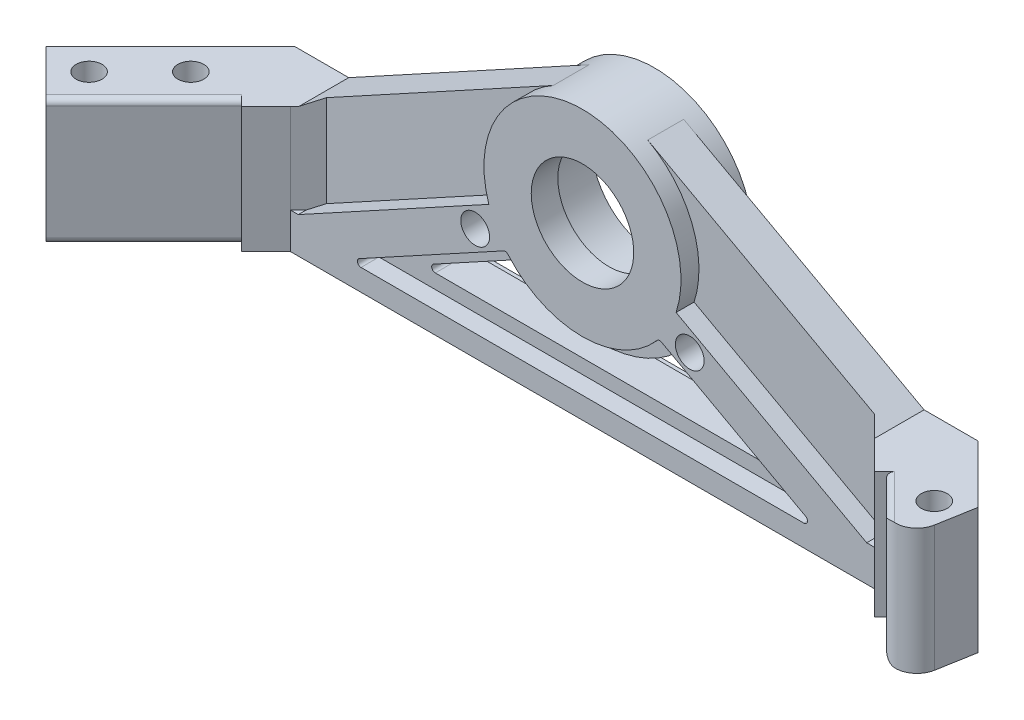
from build123d import *

# Parameters (mm, degrees)
BOSS_EXTRUDE1_DEPTH = 11.1125
BOSS_EXTRUDE2_DEPTH = 12.7
CUT_EXTRUDE2_DEPTH  = 8
CUT_EXTRUDE3_DEPTH  = 96.942967533
SKETCH5_W           = 25.144717139
SKETCH5_H           = 15.875
CUT_EXTRUDE4_DEPTH  = 3.175
CUT_EXTRUDE5_DEPTH  = 96.942967533
SKETCH6_R           = 2.54
CUT_EXTRUDE6_DEPTH  = 96.942967533
CUT_EXTRUDE7_START  = -3.175
CUT_EXTRUDE7_DEPTH  = 3.175
CHAMFER1_SIZE       = 3.175
FILLET1_R           = 0.635
FILLET3_R           = 1.016
SKETCH8_R           = 2.286
CUT_EXTRUDE8_DEPTH  = 93.295392221
CUT_EXTRUDE9_DEPTH  = 93.295392221
FILLET4_R           = 3.81
CUT_EXTRUDE10_DEPTH = 0.5


with BuildPart() as part:
    # Sketch3 → Boss-Extrude1 (new, symmetric)
    with BuildSketch(Plane(origin=(0, 0, 0), x_dir=(1, 0, 0), z_dir=(0, 1, 0))):
        Polygon((-56.934473853, -15.948934871), (-65.016704362, -7.866704362), (-82.294717139, -25.144717139), (-74.93090712, -32.508527158), (-74.21248663, -33.226947648), align=None)
        Polygon((-65.016704362, -7.866704362), (-55.873813681, -17.009595043), (-52.371513794, -13.507295156), (-61.514404475, -4.364404475), align=None)
        Polygon((-52.371513794, -13.507295156), (-51.564218639, -12.7), (-17.311249955, -12.7), (0, -12.7), (0, 0), (-17.311249955, 0), (-57.15, 0), (-60.325, -3.175), (-61.514404475, -4.364404475), align=None)
        Polygon((0, 0), (0, -12.7), (17.311249955, -12.7), (51.564218639, -12.7), (52.371513794, -13.507295156), (61.514404475, -4.364404475), (60.325, -3.175), (57.15, 0), (17.311249955, 0), align=None)
        Polygon((61.514404475, -4.364404475), (65.016704362, -7.866704362), (55.873813681, -17.009595043), (52.371513794, -13.507295156), align=None)
        Polygon((65.016704362, -7.866704362), (56.934473853, -15.948934871), (74.21248663, -33.226947648), (74.93090712, -32.508527158), (82.294717139, -25.144717139), align=None)
    extrude(amount=BOSS_EXTRUDE1_DEPTH, both=True)

    # Sketch2 → Boss-Extrude2 (add)
    with BuildSketch(Plane.XY):
        with BuildLine():
            Line((-50.804788276, 11.1125), (50.804788276, 11.1125))
            Line((50.804788276, 11.1125), (8.344749207, 34.318436746))
            ThreePointArc((8.344749207, 34.318436746), (0, 36.45), (-8.344749207, 34.318436746))
            Line((-8.344749207, 34.318436746), (-50.804788276, 11.1125))
        make_face()
    extrude(amount=BOSS_EXTRUDE2_DEPTH)

    # Sketch2<3> → Cut-Extrude2 (cut)
    with BuildSketch(Plane.XY):
        with BuildLine():
            ThreePointArc((0, 30.1), (-11.05, 19.05), (0, 8))
            Line((0, 8), (0, 10))
            ThreePointArc((0, 10), (-9.05, 19.05), (0, 28.1))
            Line((0, 28.1), (0, 30.1))
        make_face()
        with BuildLine():
            Line((0, 10), (0, 8))
            ThreePointArc((0, 8), (7.813529932, 11.236470068), (11.05, 19.05))
            ThreePointArc((11.05, 19.05), (7.813529932, 26.863529932), (0, 30.1))
            Line((0, 30.1), (0, 28.1))
            ThreePointArc((0, 28.1), (6.39931637, 25.44931637), (9.05, 19.05))
            ThreePointArc((9.05, 19.05), (6.39931637, 12.65068363), (0, 10))
        make_face()
        with BuildLine():
            ThreePointArc((0, 28.1), (-9.05, 19.05), (0, 10))
            Line((0, 10), (0, 28.1))
        make_face()
        with BuildLine():
            Line((0, 28.1), (0, 10))
            ThreePointArc((0, 10), (6.39931637, 12.65068363), (9.05, 19.05))
            ThreePointArc((9.05, 19.05), (6.39931637, 25.44931637), (0, 28.1))
        make_face()
    extrude(amount=CUT_EXTRUDE2_DEPTH, mode=Mode.SUBTRACT)

    # Sketch2<5> → Cut-Extrude3 (cut, through all)
    with BuildSketch(Plane.XY):
        with BuildLine():
            ThreePointArc((0, 28.1), (-9.05, 19.05), (0, 10))
            Line((0, 10), (0, 28.1))
        make_face()
        with BuildLine():
            Line((0, 28.1), (0, 10))
            ThreePointArc((0, 10), (6.39931637, 12.65068363), (9.05, 19.05))
            ThreePointArc((9.05, 19.05), (6.39931637, 25.44931637), (0, 28.1))
        make_face()
    extrude(amount=CUT_EXTRUDE3_DEPTH, mode=Mode.SUBTRACT)

    # Sketch5 → Cut-Extrude4 (cut)
    # profile 1 of 5: a face of its own
    with BuildSketch(Plane(origin=(0, 0, 0), x_dir=(-1, 0, 0), z_dir=(0, 0, -1))):
        with Locations((-69.72235857, 3.175)):
            Rectangle(SKETCH5_W, SKETCH5_H)
    # profile 2 of 5: a face of its own
    with BuildSketch(Plane(origin=(0, 0, 0), x_dir=(-1, 0, 0), z_dir=(0, 0, -1))):
        with BuildLine():
            Line((-50.190202202, -4.7625), (-16.534774751, 13.631400187))
            ThreePointArc((-16.534774751, 13.631400187), (-16.178258512, 25.454994263), (-8.344749207, 34.318436746))
            Line((-8.344749207, 34.318436746), (-50.804788276, 11.1125))
            Line((-50.804788276, 11.1125), (-57.15, 11.1125))
            Line((-57.15, 11.1125), (-57.15, -4.7625))
            Line((-57.15, -4.7625), (-50.190202202, -4.7625))
        make_face()
    # profile 3 of 5: a face of its own
    with BuildSketch(Plane(origin=(0, 0, 0), x_dir=(-1, 0, 0), z_dir=(0, 0, -1))):
        with BuildLine():
            Line((50.804788276, 11.1125), (8.344749207, 34.318436746))
            ThreePointArc((8.344749207, 34.318436746), (14.965938597, 27.925848236), (17.4, 19.05))
            ThreePointArc((17.4, 19.05), (17.182332215, 16.306378367), (16.534774751, 13.631400187))
            Line((16.534774751, 13.631400187), (50.190202202, -4.7625))
            Line((50.190202202, -4.7625), (57.15, -4.7625))
            Line((57.15, -4.7625), (57.15, 11.1125))
            Line((57.15, 11.1125), (50.804788276, 11.1125))
        make_face()
    # profile 4 of 5: a face of its own
    with BuildSketch(Plane(origin=(0, 0, 0), x_dir=(-1, 0, 0), z_dir=(0, 0, -1))):
        with Locations((69.72235857, 3.175)):
            Rectangle(SKETCH5_W, SKETCH5_H)
    # profile 5 of 5: a face of its own
    with BuildSketch(Plane(origin=(0, 0, 0), x_dir=(-1, 0, 0), z_dir=(0, 0, -1))):
        with BuildLine():
            ThreePointArc((13.489420874, 8.059298271), (0, 1.65), (-13.489420874, 8.059298271))
            Line((-13.489420874, 8.059298271), (-41.5969936, -7.3025))
            Line((-41.5969936, -7.3025), (41.5969936, -7.3025))
            Line((41.5969936, -7.3025), (13.489420874, 8.059298271))
        make_face()
        with BuildLine():
            Line((31.653276027, -4.7625), (-31.653276027, -4.7625))
            Line((-31.653276027, -4.7625), (-14.022402602, 4.873405723))
            ThreePointArc((-14.022402602, 4.873405723), (0, -0.89), (14.022402602, 4.873405723))
            Line((14.022402602, 4.873405723), (31.653276027, -4.7625))
        make_face(mode=Mode.SUBTRACT)
    extrude(amount=-CUT_EXTRUDE4_DEPTH, mode=Mode.SUBTRACT)

    # Sketch5<3> → Cut-Extrude5 (cut, through all)
    with BuildSketch(Plane(origin=(0, 0, 0), x_dir=(-1, 0, 0), z_dir=(0, 0, -1))):
        with BuildLine():
            ThreePointArc((-14.022402602, 4.873405723), (0, -0.89), (14.022402602, 4.873405723))
            Line((14.022402602, 4.873405723), (31.653276027, -4.7625))
            Line((31.653276027, -4.7625), (-31.653276027, -4.7625))
            Line((-31.653276027, -4.7625), (-14.022402602, 4.873405723))
        make_face()
    extrude(amount=-CUT_EXTRUDE5_DEPTH, mode=Mode.SUBTRACT)

    # Sketch6 → Cut-Extrude6 (cut, through all)
    with BuildSketch(Plane(origin=(0, 0, 0), x_dir=(-1, 0, 0), z_dir=(0, 0, -1))):
        with Locations((-18.945146514, 8.695796817)):
            Circle(SKETCH6_R)
        with Locations((18.945146514, 8.695796817)):
            Circle(SKETCH6_R)
    extrude(amount=-CUT_EXTRUDE6_DEPTH, mode=Mode.SUBTRACT)

    # Sketch7 → Cut-Extrude7 (cut)
    # profile 1 of 3: a face of its own
    with BuildSketch(Plane.XY.offset(12.7).offset(CUT_EXTRUDE7_START)):
        with BuildLine():
            ThreePointArc((13.489420874, 8.059298271), (0, 1.65), (-13.489420874, 8.059298271))
            Line((-13.489420874, 8.059298271), (-41.5969936, -7.3025))
            Line((-41.5969936, -7.3025), (41.5969936, -7.3025))
            Line((41.5969936, -7.3025), (13.489420874, 8.059298271))
        make_face()
        with BuildLine():
            Line((-31.653276027, -4.7625), (-14.022402602, 4.873405723))
            ThreePointArc((-14.022402602, 4.873405723), (0, -0.89), (14.022402602, 4.873405723))
            Line((14.022402602, 4.873405723), (31.653276027, -4.7625))
            Line((31.653276027, -4.7625), (-31.653276027, -4.7625))
        make_face(mode=Mode.SUBTRACT)
    # profile 2 of 3: a face of its own
    with BuildSketch(Plane.XY.offset(12.7).offset(CUT_EXTRUDE7_START)):
        with BuildLine():
            Line((-51.564218639, -4.7625), (-50.190202202, -4.7625))
            Line((-50.190202202, -4.7625), (-16.534774751, 13.631400187))
            ThreePointArc((-16.534774751, 13.631400187), (-16.178258512, 25.454994263), (-8.344749207, 34.318436746))
            Line((-8.344749207, 34.318436746), (-50.804788276, 11.1125))
            Line((-50.804788276, 11.1125), (-51.564218639, 11.1125))
            Line((-51.564218639, 11.1125), (-51.564218639, -4.7625))
        make_face()
    # profile 3 of 3: a face of its own
    with BuildSketch(Plane.XY.offset(12.7).offset(CUT_EXTRUDE7_START)):
        with BuildLine():
            Line((50.804788276, 11.1125), (8.344749207, 34.318436746))
            ThreePointArc((8.344749207, 34.318436746), (14.965938597, 27.925848236), (17.4, 19.05))
            ThreePointArc((17.4, 19.05), (17.182332215, 16.306378367), (16.534774751, 13.631400187))
            Line((16.534774751, 13.631400187), (50.190202202, -4.7625))
            Line((50.190202202, -4.7625), (51.564218639, -4.7625))
            Line((51.564218639, -4.7625), (51.564218639, 11.1125))
            Line((51.564218639, 11.1125), (50.804788276, 11.1125))
        make_face()
    extrude(amount=CUT_EXTRUDE7_DEPTH, mode=Mode.SUBTRACT)

    # Chamfer1
    # the kernel refuses this chamfer: 3.175 mm, written as the material it adds along each edge
    with BuildSketch(Plane(origin=(51.564218639, -4.7625, 9.525), x_dir=(0, 0, 1), z_dir=(0, 1, 0))) as chamfer1_piece_1_section:
        Polygon((CHAMFER1_SIZE, 0), (0, -CHAMFER1_SIZE), (0, 0), align=None)
    chamfer1_piece_1 = extrude(amount=24.040093487, mode=Mode.PRIVATE)
    chamfer1_piece_1 = split(chamfer1_piece_1, bisect_by=Plane(origin=(58.070266948, 7.14165489, 9.525), z_dir=(-0.47958328775301867, -0.8774963647263762, 0)), keep=Keep.TOP, mode=Mode.PRIVATE)
    add(chamfer1_piece_1)
    with BuildSketch(Plane(origin=(51.564218639, -12.927593487, 9.525), x_dir=(0, 0, 1), z_dir=(0, 1, 0))) as chamfer1_piece_2_section:
        Polygon((CHAMFER1_SIZE, 0), (0, -CHAMFER1_SIZE), (0, 0), align=None)
    chamfer1_piece_2 = extrude(amount=24.040093487, mode=Mode.PRIVATE)
    chamfer1_piece_2 = split(chamfer1_piece_2, bisect_by=Plane(origin=(61.506404401, 5.263682328, 9.525), z_dir=(0.47958328775301867, 0.8774963647263762, 0)), keep=Keep.TOP, mode=Mode.PRIVATE)
    add(chamfer1_piece_2)
    with BuildSketch(Plane(origin=(-51.564218639, 11.1125, 9.525), x_dir=(1, 0, 0), z_dir=(0, -1, 0))) as chamfer1_piece_3_section:
        Polygon((CHAMFER1_SIZE, 0), (0, CHAMFER1_SIZE), (0, 0), align=None)
    chamfer1_piece_3 = extrude(amount=24.040093487, mode=Mode.PRIVATE)
    chamfer1_piece_3 = split(chamfer1_piece_3, bisect_by=Plane(origin=(-44.567477288, -1.689478836, 9.525), z_dir=(-0.47958328775301895, 0.877496364726376, 0)), keep=Keep.TOP, mode=Mode.PRIVATE)
    add(chamfer1_piece_3)
    with BuildSketch(Plane(origin=(-51.564218639, 19.277593487, 9.525), x_dir=(1, 0, 0), z_dir=(0, -1, 0))) as chamfer1_piece_4_section:
        Polygon((CHAMFER1_SIZE, 0), (0, CHAMFER1_SIZE), (0, 0), align=None)
    chamfer1_piece_4 = extrude(amount=32.205186974, mode=Mode.PRIVATE)
    chamfer1_piece_4 = split(chamfer1_piece_4, bisect_by=Plane(origin=(-47.953412104, 12.670879515, 9.525), z_dir=(0.47958328775301867, -0.8774963647263762, 0)), keep=Keep.TOP, mode=Mode.PRIVATE)
    chamfer1_piece_4 = split(chamfer1_piece_4, bisect_by=Plane(origin=(-41.131339836, 0.188493727, 9.525), z_dir=(-0.47958328775301895, 0.877496364726376, 0)), keep=Keep.TOP, mode=Mode.PRIVATE)
    add(chamfer1_piece_4)

    # Fillet1
    fillet1_edges = [part.edges().sort_by_distance(p)[0] for p in [
        (13.489420874, 8.059298271, 1.5875),
        (-13.489420874, 8.059298271, 1.5875),
        (-41.5969936, -7.3025, 1.5875),
        (41.5969936, -7.3025, 1.5875),
        (14.022402602, 4.873405723, 6.35),
        (31.653276027, -4.7625, 6.35),
        (-31.653276027, -4.7625, 6.35),
        (-14.022402602, 4.873405723, 6.35),
        (-13.489420874, 8.059298271, 11.1125),
        (13.489420874, 8.059298271, 11.1125),
        (41.5969936, -7.3025, 11.1125),
        (-41.5969936, -7.3025, 11.1125),
    ]]
    fillet(fillet1_edges, radius=FILLET1_R)

    # Fillet3
    fillet3_edges = [part.edges().sort_by_distance(p)[0] for p in [
        (65.573480242, -11.1125, 24.587941259),
        (-65.573480242, -11.1125, 24.587941259),
        (65.573480242, 11.1125, 24.587941259),
        (-65.573480242, 11.1125, 24.587941259),
    ]]
    fillet(fillet3_edges, radius=FILLET3_R)

    # Sketch8 → Cut-Extrude8 (cut, through all)
    with BuildSketch(Plane(origin=(0, 11.1125, 0), x_dir=(1, 0, 0), z_dir=(0, 1, 0))):
        with Locations(Location((74.625578412, -25.198598676, 0), (0, 0, 270))):
            Circle(SKETCH8_R)
        with Locations(Location((-74.625578412, -25.198598676, 0), (0, 0, 270))):
            Circle(SKETCH8_R)
        with Locations(Location((65.645322291, -16.218342555, 0), (0, 0, 270))):
            Circle(SKETCH8_R)
        with Locations(Location((-65.645322291, -16.218342555, 0), (0, 0, 90))):
            Circle(SKETCH8_R)
    extrude(amount=-CUT_EXTRUDE8_DEPTH, mode=Mode.SUBTRACT)

    # Sketch9 → Cut-Extrude9 (cut, through all)
    with BuildSketch(Plane(origin=(0, 11.1125, 0), x_dir=(1, 0, 0), z_dir=(0, 1, 0))):
        Polygon((70.485, -13.335), (65.639402848, -40.815747031), (98.201631383, -40.815747031), (98.201631383, -13.335), align=None)
    extrude(amount=-CUT_EXTRUDE9_DEPTH, mode=Mode.SUBTRACT)

    # Fillet4
    # the kernel refuses this fillet: 3.81 mm, written as the material it takes off along each edge
    with BuildSketch(Plane(origin=(68.062008219, 28.393854759, 27.076469237), x_dir=(0.1736481776669248, 0, -0.9848077530122091), z_dir=(0, -1, 0))) as fillet4_piece_1:
        with BuildLine():
            CenterArc((FILLET4_R * 1.92098212697, -FILLET4_R), FILLET4_R, 90, 125)
            Line((FILLET4_R * 1.10183008268, -FILLET4_R * 1.57357643635), (0, 0))
            Line((0, 0), (FILLET4_R * 1.92098212697, 0))
        make_face()
    extrude(amount=56.787709519, mode=Mode.SUBTRACT)

    # Sketch10 → Cut-Extrude10 (cut)
    # profile 1 of 5: a face of its own
    with BuildSketch(Plane.XZ.offset(11.1125)):
        with BuildLine():
            Line((6.955128205, 5.655889423), (6.573717949, 5.452564103))
            add(Edge.make_bspline(
                [(6.573717949, 5.452564103), (6.545922437, 5.498605223), (6.492797515, 5.586602559), (6.405563696, 5.705145418), (6.318829653, 5.806231322), (6.231739217, 5.889758205), (6.143082637, 5.95438438), (6.053764997, 6.001091066), (5.963227276, 6.030447771), (5.9020118, 6.034100411), (5.871895032, 6.035897436)],
                knots=[0, 0, 0, 0, 1.354943589, 2.589672558, 3.704607527, 4.708856974, 5.624398268, 6.459549776, 7.242129862, 8, 8, 8, 8], degree=3))
            add(Edge.make_bspline(
                [(5.871895032, 6.035897436), (5.843777409, 6.034998249), (5.788084486, 6.03321722), (5.706289617, 6.017626176), (5.626860085, 5.99419681), (5.551935483, 5.959511514), (5.48244247, 5.918382044), (5.420674582, 5.869797955), (5.368082166, 5.814645054), (5.325239521, 5.753088186), (5.291507213, 5.688001962), (5.267412618, 5.620080583), (5.252956595, 5.549928839), (5.250989532, 5.502409986), (5.25, 5.478505609)],
                knots=[0, 0, 0, 0, 1.088711937, 2.156425153, 3.216543554, 4.290691142, 5.346933412, 6.339926723, 7.326538423, 8.288906172, 9.236802047, 10.159214894, 11.073992371, 12, 12, 12, 12], degree=3))
            add(Edge.make_bspline(
                [(5.25, 5.478505609), (5.251289441, 5.451237129), (5.253897944, 5.396073728), (5.277544855, 5.314729095), (5.312451573, 5.233254329), (5.346112616, 5.182849411), (5.363581731, 5.156690705)],
                knots=[0, 0, 0, 0, 0.942144539, 1.905933023, 2.913239343, 4, 4, 4, 4], degree=3))
            add(Edge.make_bspline(
                [(5.363581731, 5.156690705), (5.378599068, 5.137617448), (5.410211837, 5.097466622), (5.463771743, 5.037071303), (5.526108213, 4.973940726), (5.598480894, 4.909395911), (5.677065406, 4.839348386), (5.765885722, 4.768357575), (5.862751255, 4.693916401), (5.930689868, 4.644038805), (5.965845353, 4.618229167)],
                knots=[0, 0, 0, 0, 0.718605451, 1.5127255, 2.388525841, 3.34361075, 4.383114545, 5.504804886, 6.708837455, 8, 8, 8, 8], degree=3))
            add(Edge.make_bspline(
                [(5.965845353, 4.618229167), (6.00168954, 4.592171602), (6.070464497, 4.542174431), (6.167362407, 4.468878347), (6.254240814, 4.401295296), (6.3304335, 4.339372455), (6.395949126, 4.282571618), (6.450649678, 4.231125865), (6.496181868, 4.186447001), (6.520649569, 4.156384964), (6.531650641, 4.14286859)],
                knots=[0, 0, 0, 0, 1.435833971, 2.754963323, 3.936484598, 5.002077172, 5.935979083, 6.744956812, 7.435712417, 8, 8, 8, 8], degree=3))
            add(Edge.make_bspline(
                [(6.531650641, 4.14286859), (6.547710719, 4.122117406), (6.579262034, 4.081350037), (6.61920709, 4.015956536), (6.653578917, 3.949707187), (6.681889214, 3.881988561), (6.703827988, 3.813016997), (6.718920828, 3.742550617), (6.729567054, 3.670869327), (6.730367062, 3.622441786), (6.730769231, 3.598096955)],
                knots=[0, 0, 0, 0, 1.064105702, 2.090521257, 3.104283852, 4.09061442, 5.065433238, 6.036507983, 7.012940167, 8, 8, 8, 8], degree=3))
            add(Edge.make_bspline(
                [(6.730769231, 3.598096955), (6.729515083, 3.560126606), (6.727031963, 3.484948093), (6.704399939, 3.375068313), (6.668607851, 3.26994227), (6.617838539, 3.171328353), (6.554959306, 3.080088965), (6.479870762, 2.998403207), (6.392434284, 2.927813249), (6.294689139, 2.868139824), (6.189328785, 2.819749269), (6.078360338, 2.785257467), (5.963128198, 2.764347606), (5.884835503, 2.761630248), (5.845252404, 2.76025641)],
                knots=[0, 0, 0, 0, 1.004538361, 1.98891246, 2.957754601, 3.937604432, 4.916182936, 5.884154884, 6.865254872, 7.882148152, 8.909646262, 9.927556077, 10.952217026, 12, 12, 12, 12], degree=3))
            add(Edge.make_bspline(
                [(5.845252404, 2.76025641), (5.800288489, 2.761765646), (5.711198198, 2.764756006), (5.58029896, 2.787799883), (5.45446477, 2.825234465), (5.353568286, 2.868466228), (5.275055104, 2.912290321), (5.215686682, 2.951924562), (5.154833361, 2.996764375), (5.09442727, 3.049062555), (5.032112714, 3.106283691), (4.9710811, 3.171539686), (4.907469941, 3.241090211), (4.86692652, 3.291248304), (4.846153846, 3.316947115)],
                knots=[0, 0, 0, 0, 1.360687177, 2.696028959, 4.010076158, 5.328383209, 6.009416266, 6.72960499, 7.488083515, 8.296188009, 9.147227534, 10.04798982, 10.999875445, 12, 12, 12, 12], degree=3))
            Line((4.846153846, 3.316947115), (5.212139423, 3.567948718))
            add(Edge.make_bspline(
                [(5.212139423, 3.567948718), (5.231197788, 3.547515179), (5.267953877, 3.508106922), (5.322642771, 3.45291865), (5.373784064, 3.403079657), (5.421450494, 3.358595495), (5.466336542, 3.319984295), (5.508000192, 3.286910753), (5.546973362, 3.260282729), (5.593160244, 3.230943128), (5.651920246, 3.204105222), (5.723895671, 3.180794058), (5.798937681, 3.16714817), (5.849638961, 3.165128681), (5.875400641, 3.164102564)],
                knots=[0, 0, 0, 0, 1.253255604, 2.417037033, 3.484535688, 4.456276324, 5.340879413, 6.139846054, 6.840628373, 7.457335203, 8.592193832, 9.725986821, 10.844557802, 12, 12, 12, 12], degree=3))
            add(Edge.make_bspline(
                [(5.875400641, 3.164102564), (5.902885124, 3.165396572), (5.956317203, 3.167912228), (6.032932005, 3.189110321), (6.103119698, 3.223200893), (6.165194449, 3.27097975), (6.217718177, 3.329639699), (6.255574284, 3.399162998), (6.277829561, 3.478036176), (6.280604327, 3.533445496), (6.282051282, 3.562339744)],
                knots=[0, 0, 0, 0, 1.033786987, 2.00976631, 2.970458119, 3.95651055, 4.942051941, 5.915168215, 6.91282465, 8, 8, 8, 8], degree=3))
            add(Edge.make_bspline(
                [(6.282051282, 3.562339744), (6.28149088, 3.581062134), (6.28037143, 3.618461629), (6.272009308, 3.67382967), (6.256922644, 3.72753238), (6.23645815, 3.780017787), (6.209395004, 3.831703254), (6.175597302, 3.882906129), (6.134357789, 3.933943781), (6.102846717, 3.966210779), (6.086438301, 3.983012821)],
                knots=[0, 0, 0, 0, 0.941102048, 1.879927795, 2.806320176, 3.740133313, 4.70706341, 5.733547381, 6.819814909, 8, 8, 8, 8], degree=3))
            add(Edge.make_bspline(
                [(6.086438301, 3.983012821), (6.078121626, 3.990836739), (6.059033112, 4.008794272), (6.024022728, 4.036292581), (5.981368032, 4.070768116), (5.930477678, 4.111658174), (5.869678278, 4.156742774), (5.801217798, 4.209033937), (5.723362816, 4.266177574), (5.668576046, 4.306239142), (5.639823718, 4.327263622)],
                knots=[0, 0, 0, 0, 0.485581606, 1.114511607, 1.892484918, 2.819534315, 3.891398566, 5.11240712, 6.484579029, 8, 8, 8, 8], degree=3))
            add(Edge.make_bspline(
                [(5.639823718, 4.327263622), (5.600647247, 4.355810699), (5.524859001, 4.411036014), (5.417274927, 4.494420765), (5.320111394, 4.575739513), (5.231859623, 4.653699656), (5.153297125, 4.728862304), (5.085159515, 4.802258672), (5.025718972, 4.871778844), (4.962356185, 4.960505052), (4.898616052, 5.06962878), (4.843298524, 5.202280536), (4.808089766, 5.335069751), (4.80353079, 5.424082684), (4.801282051, 5.467988782)],
                knots=[0, 0, 0, 0, 1.186639563, 2.29559556, 3.331401308, 4.287832086, 5.178002532, 5.991653193, 6.738845359, 7.415240842, 8.658551622, 9.823054859, 10.926210341, 12, 12, 12, 12], degree=3))
            add(Edge.make_bspline(
                [(4.801282051, 5.467988782), (4.802275506, 5.499122385), (4.804250073, 5.561002801), (4.818566607, 5.652496737), (4.842387021, 5.741426577), (4.876660762, 5.827412615), (4.919396348, 5.91127786), (4.972439298, 5.992227342), (5.035257903, 6.070059394), (5.106262482, 6.144446648), (5.183899032, 6.213576047), (5.267788427, 6.274099775), (5.356348148, 6.325831589), (5.450294329, 6.366808857), (5.548106527, 6.400426022), (5.651087312, 6.423387681), (5.758665045, 6.436656939), (5.831894176, 6.438703864), (5.869090545, 6.43974359)],
                knots=[0, 0, 0, 0, 0.932738639, 1.853889356, 2.767877299, 3.686041414, 4.622558463, 5.584089528, 6.580490983, 7.61578374, 8.662665956, 9.690923261, 10.710750907, 11.729736566, 12.757349726, 13.805636525, 14.885384091, 16, 16, 16, 16], degree=3))
            add(Edge.make_bspline(
                [(5.869090545, 6.43974359), (5.896214412, 6.439141134), (5.949637214, 6.437954545), (6.028947511, 6.430427802), (6.106126309, 6.415961477), (6.181596753, 6.397257975), (6.255405946, 6.373441591), (6.326602693, 6.34297607), (6.396372582, 6.307982208), (6.464315382, 6.267008021), (6.530517733, 6.219030474), (6.595355852, 6.163337979), (6.658453112, 6.09895153), (6.720891134, 6.026707642), (6.781845028, 5.945793723), (6.841172492, 5.856635242), (6.899631031, 5.759519711), (6.936264526, 5.691113712), (6.955128205, 5.655889423)],
                knots=[0, 0, 0, 0, 0.916943493, 1.805999526, 2.689245248, 3.568702553, 4.433092864, 5.307568578, 6.183755457, 7.069823058, 7.986358083, 8.944343836, 9.955449961, 11.030835633, 12.170024038, 13.377301724, 14.649494474, 16, 16, 16, 16], degree=3))
        make_face()
    # profile 2 of 5: a face of its own
    with BuildSketch(Plane.XZ.offset(11.1125)):
        Polygon((4.128205128, 6.35), (4.128205128, 2.85), (3.962039263, 2.85), (1.83974359, 5.509354968), (1.83974359, 2.85), (1.391025641, 2.85), (1.391025641, 6.35), (1.574719551, 6.35), (3.679487179, 3.69765625), (3.679487179, 6.35), align=None)
    # profile 3 of 5: a face of its own
    with BuildSketch(Plane.XZ.offset(11.1125)):
        Polygon((0.043469551, 2.85), (-0.717948718, 2.85), (-0.717948718, 6.35), (-0.269230769, 6.35), (-0.269230769, 3.253846154), (0.269230769, 3.253846154), align=None)
    # profile 4 of 5: a face of its own
    with BuildSketch(Plane.XZ.offset(11.1125)):
        with BuildLine():
            add(Edge.make_bspline(
                [(-1.929487179, 4.601402244), (-1.929820024, 4.545772786), (-1.930466421, 4.437738209), (-1.937473576, 4.280579568), (-1.949475503, 4.133047998), (-1.965186437, 3.99497525), (-1.985981936, 3.866455085), (-2.01210377, 3.747657913), (-2.041666608, 3.638070524), (-2.077057072, 3.537721733), (-2.116884293, 3.445335588), (-2.159279173, 3.358445926), (-2.207248145, 3.277982304), (-2.258445983, 3.202763868), (-2.313138476, 3.132633266), (-2.372968524, 3.069102006), (-2.436199286, 3.01043296), (-2.503346552, 2.957979374), (-2.573759685, 2.911897493), (-2.645716894, 2.870677498), (-2.720506077, 2.837466064), (-2.796608784, 2.808773511), (-2.875043288, 2.787234356), (-2.955710335, 2.771953379), (-3.038153153, 2.761483068), (-3.094018037, 2.760666707), (-3.122095353, 2.76025641)],
                knots=[0, 0, 0, 0, 1.622605109, 3.151162473, 4.587442309, 5.939538287, 7.20372481, 8.383107478, 9.486239959, 10.512528934, 11.483748244, 12.419707751, 13.330476935, 14.213498841, 15.072700274, 15.92158999, 16.756207925, 17.586695167, 18.403499641, 19.2093348, 20.002585959, 20.787710657, 21.579935901, 22.371427536, 23.181490415, 24, 24, 24, 24], degree=3))
            add(Edge.make_bspline(
                [(-3.122095353, 2.76025641), (-3.152731517, 2.761033674), (-3.213201864, 2.762567854), (-3.302787896, 2.771651823), (-3.389864801, 2.78757717), (-3.474185977, 2.81134458), (-3.556619955, 2.83954235), (-3.63604835, 2.875891171), (-3.713266346, 2.917848905), (-3.787678328, 2.966252878), (-3.858415308, 3.020964068), (-3.925441203, 3.081687718), (-3.988267508, 3.148014653), (-4.046907915, 3.220326578), (-4.101416121, 3.2977732), (-4.151425746, 3.381374377), (-4.197578861, 3.470324753), (-4.240034798, 3.565409639), (-4.277149587, 3.667580194), (-4.309407109, 3.777408534), (-4.336484753, 3.895211611), (-4.358892888, 4.021105793), (-4.376144672, 4.154950988), (-4.388881636, 4.296670021), (-4.395532446, 4.44639057), (-4.396790125, 4.548812409), (-4.397435897, 4.601402244)],
                knots=[0, 0, 0, 0, 0.874832558, 1.726764085, 2.568361456, 3.398879789, 4.226201588, 5.053523386, 5.889679481, 6.733707388, 7.585299078, 8.4404393, 9.313717912, 10.191269597, 11.096596538, 12.015593249, 12.970707924, 13.956566593, 14.986800884, 16.072143337, 17.223061702, 18.436511454, 19.721974523, 21.075312687, 22.498281019, 24, 24, 24, 24], degree=3))
            add(Edge.make_bspline(
                [(-4.397435897, 4.601402244), (-4.396782502, 4.653757336), (-4.395510127, 4.755709971), (-4.388966535, 4.904744814), (-4.375857992, 5.045682145), (-4.359906802, 5.178975556), (-4.336868841, 5.303968911), (-4.311081981, 5.421313071), (-4.278377775, 5.530191748), (-4.241956283, 5.631910666), (-4.200730937, 5.726917543), (-4.153785212, 5.815343618), (-4.104592007, 5.899021968), (-4.050060208, 5.976726285), (-3.991471708, 6.048656628), (-3.928478795, 6.115269439), (-3.861485674, 6.17603404), (-3.790212069, 6.231128369), (-3.715479627, 6.279794991), (-3.638364874, 6.322876937), (-3.558372006, 6.358984162), (-3.47592898, 6.388001652), (-3.391043214, 6.411839285), (-3.303435357, 6.427402676), (-3.213482705, 6.437646554), (-3.152739512, 6.439040408), (-3.122095353, 6.43974359)],
                knots=[0, 0, 0, 0, 1.49659969, 2.914373258, 4.262463443, 5.541784011, 6.749918813, 7.89402581, 8.97408983, 9.996834451, 10.981022981, 11.93120719, 12.856888794, 13.753851156, 14.64171265, 15.506454614, 16.371918745, 17.224394982, 18.078544691, 18.918788586, 19.746969722, 20.583674387, 21.415055378, 22.264095942, 23.124258755, 24, 24, 24, 24], degree=3))
            add(Edge.make_bspline(
                [(-3.122095353, 6.43974359), (-3.09379246, 6.439262863), (-3.037736562, 6.438310748), (-2.954962623, 6.428966204), (-2.874322736, 6.413472536), (-2.796083047, 6.391704526), (-2.719785436, 6.364330767), (-2.645951414, 6.33048748), (-2.574212715, 6.290386167), (-2.504974112, 6.244015703), (-2.438313207, 6.192389521), (-2.375492482, 6.134420479), (-2.316719786, 6.07040235), (-2.26121611, 6.000976337), (-2.209744799, 5.925591128), (-2.163065245, 5.843940476), (-2.119409324, 5.756680398), (-2.07933584, 5.66314306), (-2.043193198, 5.562154409), (-2.012518016, 5.452245215), (-1.986781079, 5.333047342), (-1.966139854, 5.20450334), (-1.949205111, 5.067012571), (-1.937551448, 4.920113235), (-1.930454678, 4.763900402), (-1.929815614, 4.656565118), (-1.929487179, 4.601402244)],
                knots=[0, 0, 0, 0, 0.826227461, 1.636402404, 2.428761462, 3.221854935, 4.005495932, 4.793404576, 5.590831925, 6.402844393, 7.224663165, 8.050552332, 8.895728592, 9.760111832, 10.644101474, 11.558317463, 12.504453911, 13.491971134, 14.528097073, 15.634271589, 16.821614375, 18.087186367, 19.434798266, 20.865849934, 22.389264722, 24, 24, 24, 24], degree=3))
        make_face()
        with BuildLine():
            add(Edge.make_bspline(
                [(-2.378205128, 4.6), (-2.378419726, 4.646978143), (-2.378835172, 4.737924313), (-2.383553365, 4.869584142), (-2.392507878, 4.992010362), (-2.402014458, 5.10560144), (-2.417187446, 5.210052574), (-2.43417632, 5.305659219), (-2.455212435, 5.392009987), (-2.479161501, 5.469956862), (-2.506024847, 5.540860229), (-2.535825564, 5.606139939), (-2.566716304, 5.667314607), (-2.601696035, 5.722840453), (-2.637826639, 5.774385586), (-2.677248131, 5.820847469), (-2.719335124, 5.862303347), (-2.777555397, 5.909959052), (-2.852043249, 5.959857009), (-2.944753063, 6.00300953), (-3.038190548, 6.031176958), (-3.101340061, 6.03433403), (-3.132612179, 6.035897436)],
                knots=[0, 0, 0, 0, 1.565050911, 3.029821469, 4.387792543, 5.654509782, 6.826079957, 7.902709307, 8.888453275, 9.784884885, 10.617798265, 11.412307314, 12.174931846, 12.898730956, 13.596561216, 14.270483471, 14.92565982, 15.561680851, 16.775288496, 17.900403612, 18.96026391, 20, 20, 20, 20], degree=3))
            add(Edge.make_bspline(
                [(-3.132612179, 6.035897436), (-3.168054227, 6.034058471), (-3.238491124, 6.030403744), (-3.34261479, 6.00330136), (-3.442241405, 5.957590126), (-3.521609932, 5.906501163), (-3.581382078, 5.856874548), (-3.624246304, 5.8146102), (-3.66449279, 5.768073914), (-3.701752084, 5.716682081), (-3.735741366, 5.660292891), (-3.768453883, 5.600087809), (-3.796952303, 5.534691513), (-3.813420097, 5.489117655), (-3.821814904, 5.465885417)],
                knots=[0, 0, 0, 0, 1.332284016, 2.647757677, 4.016941371, 5.440902831, 6.183743781, 6.935888695, 7.702483601, 8.495487208, 9.320161261, 10.177499591, 11.070941831, 12, 12, 12, 12], degree=3))
            add(Edge.make_bspline(
                [(-3.821814904, 5.465885417), (-3.831929041, 5.435361862), (-3.85254741, 5.373137481), (-3.878379392, 5.276258244), (-3.899765093, 5.174602806), (-3.918179373, 5.068712538), (-3.932161364, 4.95805397), (-3.941825857, 4.842733688), (-3.947369549, 4.722750985), (-3.948263486, 4.641371816), (-3.948717949, 4.6)],
                knots=[0, 0, 0, 0, 0.877617242, 1.789083553, 2.735016418, 3.71249782, 4.722174671, 5.778575778, 6.870664861, 8, 8, 8, 8], degree=3))
            add(Edge.make_bspline(
                [(-3.948717949, 4.6), (-3.948608725, 4.558624069), (-3.948395719, 4.477934078), (-3.94209743, 4.359902323), (-3.934450595, 4.247559434), (-3.921345323, 4.141010587), (-3.906323118, 4.040122019), (-3.88762759, 3.944993441), (-3.86425341, 3.856240158), (-3.8386314, 3.772957339), (-3.808880154, 3.695983195), (-3.777431111, 3.62396806), (-3.743341134, 3.557627664), (-3.706562256, 3.496727767), (-3.667551009, 3.441112765), (-3.625087361, 3.391371184), (-3.581383507, 3.346161322), (-3.519748428, 3.295331926), (-3.439673756, 3.243599562), (-3.339527163, 3.197463773), (-3.236699524, 3.169660171), (-3.167126865, 3.16594543), (-3.132612179, 3.164102564)],
                knots=[0, 0, 0, 0, 1.352790526, 2.638168002, 3.864385692, 5.034146782, 6.147421261, 7.199576936, 8.202392153, 9.147488116, 10.047345819, 10.899361637, 11.716276266, 12.484327605, 13.224378387, 13.934792477, 14.621120528, 15.277699797, 16.543226194, 17.726613715, 18.872183198, 20, 20, 20, 20], degree=3))
            add(Edge.make_bspline(
                [(-3.132612179, 3.164102564), (-3.101339883, 3.165675934), (-3.037964587, 3.16886447), (-2.94442002, 3.196995009), (-2.851470398, 3.239173971), (-2.777333691, 3.288883), (-2.719393381, 3.336106603), (-2.677871857, 3.377736352), (-2.639393929, 3.424685422), (-2.60210402, 3.475253981), (-2.568451882, 3.531748057), (-2.536289512, 3.592202677), (-2.506803475, 3.657781758), (-2.479852598, 3.728630034), (-2.455862309, 3.806581762), (-2.435063373, 3.893245794), (-2.4167274, 3.988867426), (-2.403286812, 4.093823841), (-2.392094758, 4.207456057), (-2.38369602, 4.330196594), (-2.378797858, 4.46207185), (-2.378407017, 4.55302055), (-2.378205128, 4.6)],
                knots=[0, 0, 0, 0, 1.039553373, 2.106721005, 3.228374519, 4.430983397, 5.066892657, 5.71642622, 6.385219945, 7.087472665, 7.807071781, 8.573169906, 9.367539334, 10.200306343, 11.096580419, 12.082151159, 13.167672988, 14.337976248, 15.605212313, 16.970710972, 18.435224121, 20, 20, 20, 20], degree=3))
        make_face(mode=Mode.SUBTRACT)
    # profile 5 of 5: a face of its own
    with BuildSketch(Plane.XZ.offset(11.1125)):
        with BuildLine():
            Line((-5.231770833, 3.702564103), (-4.801282051, 3.702564103))
            add(Edge.make_bspline(
                [(-4.801282051, 3.702564103), (-4.810054364, 3.663848816), (-4.827226018, 3.588064302), (-4.86201322, 3.479841193), (-4.900861717, 3.37868659), (-4.946767565, 3.285624176), (-4.9983506, 3.200033902), (-5.056210502, 3.122382817), (-5.119525463, 3.052548335), (-5.188435718, 2.990606695), (-5.262247957, 2.936969991), (-5.338863922, 2.889791104), (-5.418351853, 2.849232702), (-5.501784738, 2.817424651), (-5.587744828, 2.790729419), (-5.677669506, 2.774040711), (-5.770137468, 2.761947203), (-5.833058044, 2.760824356), (-5.864883814, 2.76025641)],
                knots=[0, 0, 0, 0, 1.225428573, 2.39875556, 3.507218774, 4.569213266, 5.599106563, 6.589389512, 7.555088977, 8.505755173, 9.445563814, 10.369044218, 11.282541983, 12.196666856, 13.12375066, 14.057999571, 15.017719415, 16, 16, 16, 16], degree=3))
            add(Edge.make_bspline(
                [(-5.864883814, 2.76025641), (-5.914312333, 2.761814042), (-6.012189682, 2.764898434), (-6.156123366, 2.791373028), (-6.295220647, 2.832371654), (-6.426657594, 2.890688062), (-6.548146228, 2.96099825), (-6.654991065, 3.043976797), (-6.747326733, 3.135930105), (-6.82227954, 3.238099255), (-6.880795332, 3.34548638), (-6.92373616, 3.455374999), (-6.950153458, 3.566933362), (-6.953478911, 3.642131668), (-6.955128205, 3.679427083)],
                knots=[0, 0, 0, 0, 1.126567398, 2.230805905, 3.327012353, 4.427358373, 5.502495803, 6.520759924, 7.504549478, 8.465146869, 9.400232474, 10.286213973, 11.150029231, 12, 12, 12, 12], degree=3))
            add(Edge.make_bspline(
                [(-6.955128205, 3.679427083), (-6.953981477, 3.715740056), (-6.951738138, 3.786778991), (-6.932231862, 3.890048292), (-6.900866751, 3.98692499), (-6.85599845, 4.077006936), (-6.798818426, 4.160474511), (-6.728272267, 4.236606848), (-6.645753032, 4.306791339), (-6.583364618, 4.346240261), (-6.551282051, 4.366526442)],
                knots=[0, 0, 0, 0, 1.039530957, 2.033630564, 2.999111873, 3.948297759, 4.906578666, 5.887513816, 6.913676835, 8, 8, 8, 8], degree=3))
            add(Edge.make_bspline(
                [(-6.551282051, 4.366526442), (-6.585983847, 4.381328995), (-6.65504664, 4.410788728), (-6.748682676, 4.474663373), (-6.835836354, 4.549322587), (-6.884265752, 4.60944088), (-6.908854167, 4.639963942)],
                knots=[0, 0, 0, 0, 0.990869152, 1.972007201, 2.970354142, 4, 4, 4, 4], degree=3))
            add(Edge.make_bspline(
                [(-6.908854167, 4.639963942), (-6.926707843, 4.664746742), (-6.961972086, 4.713697257), (-7.008631257, 4.790200188), (-7.046979144, 4.868827317), (-7.078648946, 4.948571455), (-7.104417735, 5.029225572), (-7.121644487, 5.111706019), (-7.132638567, 5.195421035), (-7.133954332, 5.251775248), (-7.134615385, 5.280088141)],
                knots=[0, 0, 0, 0, 1.06051876, 2.094716566, 3.107417187, 4.094590767, 5.072613568, 6.043640383, 7.017106287, 8, 8, 8, 8], degree=3))
            add(Edge.make_bspline(
                [(-7.134615385, 5.280088141), (-7.132864026, 5.328874822), (-7.129351244, 5.426728582), (-7.096340287, 5.571269842), (-7.046641409, 5.713904744), (-6.987640713, 5.828406726), (-6.93156474, 5.916752754), (-6.885134406, 5.980596979), (-6.833682475, 6.039807336), (-6.779177427, 6.096327829), (-6.71982041, 6.148252454), (-6.656597294, 6.196745274), (-6.589119999, 6.241688916), (-6.517841022, 6.28270189), (-6.443742461, 6.320299936), (-6.366251186, 6.351361656), (-6.287059375, 6.378947574), (-6.205636897, 6.401624502), (-6.121627087, 6.418019644), (-6.035602927, 6.431079198), (-5.947019911, 6.437765336), (-5.887328587, 6.4390796), (-5.857171474, 6.43974359)],
                knots=[0, 0, 0, 0, 1.521866557, 3.052479896, 4.608662052, 6.231283321, 7.061609062, 7.876352764, 8.694295264, 9.509954189, 10.327179682, 11.155062904, 11.997336851, 12.857547182, 13.722699517, 14.590312298, 15.462977838, 16.341425706, 17.227634906, 18.135117105, 19.057828191, 20, 20, 20, 20], degree=3))
            add(Edge.make_bspline(
                [(-5.857171474, 6.43974359), (-5.819048353, 6.43889179), (-5.744015777, 6.437215308), (-5.633998139, 6.425324755), (-5.528678877, 6.404952232), (-5.428514277, 6.376270548), (-5.332953373, 6.33957855), (-5.242220483, 6.294708786), (-5.156526964, 6.24106585), (-5.075515154, 6.179950939), (-4.99974085, 6.110477487), (-4.931770263, 6.030419275), (-4.870056414, 5.94190923), (-4.814693835, 5.844209293), (-4.767800788, 5.736709509), (-4.726205558, 5.620632865), (-4.691605762, 5.49525955), (-4.675142648, 5.407832203), (-4.666666667, 5.362820513)],
                knots=[0, 0, 0, 0, 1.032221162, 2.031581103, 2.992200193, 3.933616754, 4.849131546, 5.760437255, 6.670049473, 7.58260678, 8.505115742, 9.447552716, 10.420145568, 11.423305295, 12.482866175, 13.591792644, 14.760142141, 16, 16, 16, 16], degree=3))
            Line((-4.666666667, 5.362820513), (-5.102063301, 5.362820513))
            add(Edge.make_bspline(
                [(-5.102063301, 5.362820513), (-5.110745779, 5.392560291), (-5.127381749, 5.44954288), (-5.154582622, 5.530957784), (-5.184181042, 5.604196595), (-5.21377171, 5.670372322), (-5.245648038, 5.728384333), (-5.278376052, 5.778990103), (-5.312428966, 5.822523922), (-5.338039048, 5.846412601), (-5.350260417, 5.8578125)],
                knots=[0, 0, 0, 0, 1.326235067, 2.541118661, 3.672517805, 4.706670852, 5.642457319, 6.50267409, 7.285462191, 8, 8, 8, 8], degree=3))
            add(Edge.make_bspline(
                [(-5.350260417, 5.8578125), (-5.367957058, 5.872246541), (-5.403006211, 5.900833937), (-5.460664203, 5.936332308), (-5.520237383, 5.967453216), (-5.583006076, 5.993133179), (-5.649058167, 6.011428722), (-5.717605665, 6.025863219), (-5.788952039, 6.034292332), (-5.837518698, 6.035358344), (-5.862079327, 6.035897436)],
                knots=[0, 0, 0, 0, 0.988930481, 1.95863014, 2.928276878, 3.900882764, 4.891679544, 5.895034191, 6.935498435, 8, 8, 8, 8], degree=3))
            add(Edge.make_bspline(
                [(-5.862079327, 6.035897436), (-5.89248659, 6.035187013), (-5.952060413, 6.033795155), (-6.03912178, 6.024003766), (-6.121563564, 6.007346481), (-6.198963293, 5.983342077), (-6.271885035, 5.953106609), (-6.340207751, 5.915961706), (-6.403530088, 5.871267198), (-6.461978448, 5.821246697), (-6.514458282, 5.766667869), (-6.560190348, 5.709100508), (-6.598777394, 5.649381288), (-6.631148643, 5.58766073), (-6.655343699, 5.523268782), (-6.673069827, 5.45683175), (-6.683966786, 5.388187224), (-6.685247522, 5.341593089), (-6.685897436, 5.317948718)],
                knots=[0, 0, 0, 0, 1.196896497, 2.34495615, 3.443780172, 4.503030251, 5.529902508, 6.546835454, 7.557548568, 8.575396658, 9.570921634, 10.533596172, 11.465034682, 12.366174364, 13.271764608, 14.166636317, 15.069652593, 16, 16, 16, 16], degree=3))
            add(Edge.make_bspline(
                [(-6.685897436, 5.317948718), (-6.684500608, 5.286756488), (-6.681708837, 5.22441414), (-6.66058725, 5.132722364), (-6.626452847, 5.043693181), (-6.578890712, 4.959213754), (-6.520564128, 4.88034408), (-6.450156542, 4.812046719), (-6.370752589, 4.753308211), (-6.296732641, 4.712249162), (-6.229465809, 4.685443825), (-6.170660726, 4.666778974), (-6.103779254, 4.649715632), (-6.028817177, 4.63677244), (-5.946525859, 4.622574347), (-5.856125572, 4.612709941), (-5.757693438, 4.604301832), (-5.68938065, 4.600088367), (-5.653846154, 4.597896635)],
                knots=[0, 0, 0, 0, 1.058674469, 2.115919664, 3.178751869, 4.287398255, 5.398655762, 6.498801839, 7.605315034, 8.745590957, 9.361710803, 10.062062169, 10.839820921, 11.703848335, 12.644707964, 13.675551425, 14.790883632, 16, 16, 16, 16], degree=3))
            Line((-5.653846154, 4.597896635), (-5.653846154, 4.196153846))
            add(Edge.make_bspline(
                [(-5.653846154, 4.196153846), (-5.700159814, 4.195278869), (-5.789068099, 4.193599177), (-5.916821824, 4.179024843), (-6.03286803, 4.154051728), (-6.136780942, 4.119680023), (-6.228220825, 4.078868227), (-6.305889426, 4.031591005), (-6.371046773, 3.980708993), (-6.421620632, 3.923826393), (-6.459025785, 3.863364132), (-6.486263821, 3.800867074), (-6.50311079, 3.735457824), (-6.505304691, 3.690742423), (-6.506410256, 3.668209135)],
                knots=[0, 0, 0, 0, 1.497634537, 2.875007463, 4.151598509, 5.330064984, 6.409215852, 7.382813516, 8.264671157, 9.073210975, 9.830403761, 10.554973034, 11.271812185, 12, 12, 12, 12], degree=3))
            add(Edge.make_bspline(
                [(-6.506410256, 3.668209135), (-6.505900752, 3.651576179), (-6.504896516, 3.618792533), (-6.495961503, 3.570348751), (-6.482172631, 3.523434255), (-6.462172187, 3.478092012), (-6.436854775, 3.434704618), (-6.40612911, 3.392615025), (-6.369761113, 3.352182088), (-6.327938334, 3.313951163), (-6.281721893, 3.27894709), (-6.232011026, 3.248101025), (-6.179183366, 3.222017409), (-6.123213973, 3.200995424), (-6.064407561, 3.184090965), (-6.002230272, 3.172241211), (-5.937035179, 3.165108615), (-5.892479723, 3.164442007), (-5.869791667, 3.164102564)],
                knots=[0, 0, 0, 0, 0.884781652, 1.743909417, 2.613870149, 3.483029771, 4.375042785, 5.283392817, 6.252590612, 7.265294722, 8.295503002, 9.334762477, 10.3752873, 11.426690145, 12.513638256, 13.628775998, 14.792550505, 16, 16, 16, 16], degree=3))
            add(Edge.make_bspline(
                [(-5.869791667, 3.164102564), (-5.837214858, 3.165513589), (-5.773552181, 3.16827106), (-5.681009476, 3.188027612), (-5.595451531, 3.22241756), (-5.528563499, 3.261152504), (-5.47822963, 3.300961563), (-5.441329296, 3.338536028), (-5.404456983, 3.382559411), (-5.368597121, 3.433342104), (-5.333151329, 3.491022859), (-5.298508423, 3.555256417), (-5.263906362, 3.626281025), (-5.24274509, 3.676513493), (-5.231770833, 3.702564103)],
                knots=[0, 0, 0, 0, 1.306356874, 2.552925792, 3.773170204, 4.991793267, 5.638872547, 6.341486723, 7.100030023, 7.940195678, 8.83250228, 9.814048046, 10.866363088, 12, 12, 12, 12], degree=3))
        make_face()
    extrude(amount=-CUT_EXTRUDE10_DEPTH, mode=Mode.SUBTRACT)


solid = part.part
